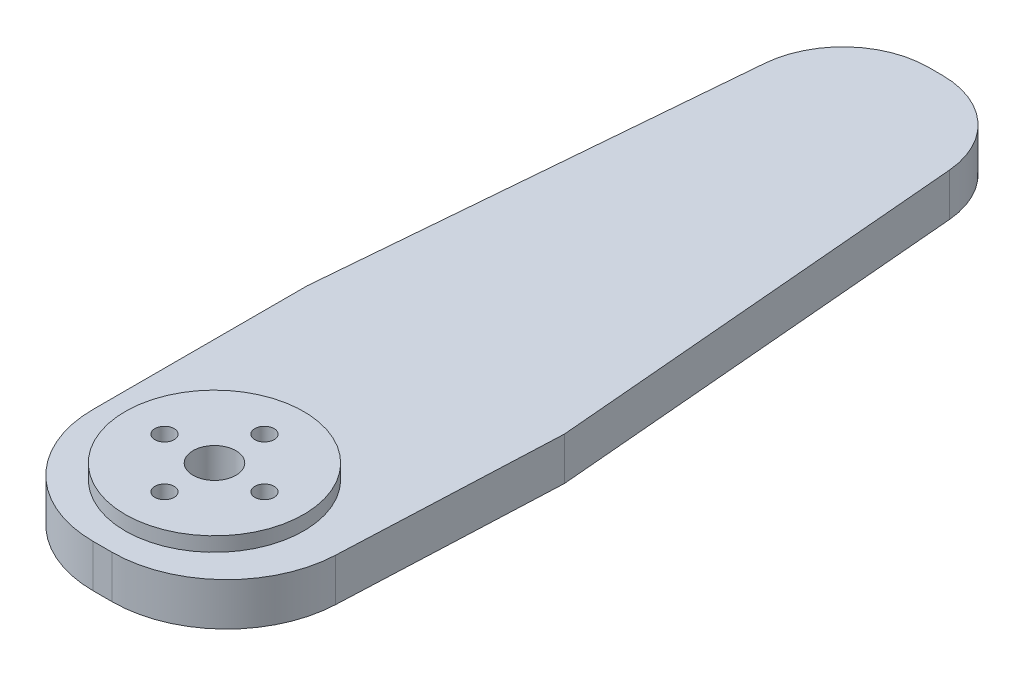
from build123d import *

# Parameters (mm, degrees)
BOSS_1_DEPTH = 6
S_CYL2_R     = 12.5
BOSS_2_DEPTH = 2
S_HOLE3_R    = 3
HOLE_3_DEPTH = 8.2
S_HOLE4_R    = 1.35
HOLE_4_DEPTH = 8.2
S_HOLE5_R    = 1.35
HOLE_5_DEPTH = 8.2
S_HOLE6_R    = 1.35
HOLE_6_DEPTH = 8.2
S_HOLE7_R    = 1.35
HOLE_7_DEPTH = 8.2


with BuildPart() as part:
    # S_prism1 → Boss_1 (new body)
    with BuildSketch(Plane(origin=(0, 0, 0), x_dir=(1, 0, 0), z_dir=(0, 1, 0))):
        with BuildLine():
            Line((-1, -16), (1.6805, -16))
            ThreePointArc((1.6805, -16), (12.745771818, -11.556826983), (17.6654, -0.695))
            Line((17.6654, -0.695), (19, 30))
            Line((19, 30), (13.9407, 89.0248))
            ThreePointArc((13.9407, 89.0248), (10.099439666, 96.840163588), (1.9846, 100))
            Line((1.9846, 100), (0.0154, 100))
            ThreePointArc((0.0154, 100), (-8.099439666, 96.840163588), (-11.9407, 89.0248))
            Line((-11.9407, 89.0248), (-17, 30))
            Line((-17, 30), (-17, 0))
            ThreePointArc((-17, 0), (-12.3137, -11.3137), (-1, -16))
        make_face()
    extrude(amount=BOSS_1_DEPTH)

    # S_cyl2 → Boss_2 (add)
    with BuildSketch(Plane(origin=(0, 6, 0), x_dir=(1, 0, 0), z_dir=(0, 1, 0))):
        Circle(S_CYL2_R)
    extrude(amount=BOSS_2_DEPTH)

    # S_hole3 → Hole_3 (cut)
    with BuildSketch(Plane(origin=(0, -0.1, 0), x_dir=(1, 0, 0), z_dir=(0, 1, 0))):
        Circle(S_HOLE3_R)
    extrude(amount=HOLE_3_DEPTH, mode=Mode.SUBTRACT)

    # S_hole4 → Hole_4 (cut)
    with BuildSketch(Plane(origin=(0, -0.1, 0), x_dir=(1, 0, 0), z_dir=(0, 1, 0))):
        with Locations((7, 0)):
            Circle(S_HOLE4_R)
    extrude(amount=HOLE_4_DEPTH, mode=Mode.SUBTRACT)

    # S_hole5 → Hole_5 (cut)
    with BuildSketch(Plane(origin=(0, -0.1, 0), x_dir=(1, 0, 0), z_dir=(0, 1, 0))):
        with Locations((0, -7)):
            Circle(S_HOLE5_R)
    extrude(amount=HOLE_5_DEPTH, mode=Mode.SUBTRACT)

    # S_hole6 → Hole_6 (cut)
    with BuildSketch(Plane(origin=(0, -0.1, 0), x_dir=(1, 0, 0), z_dir=(0, 1, 0))):
        with Locations((-7, 0)):
            Circle(S_HOLE6_R)
    extrude(amount=HOLE_6_DEPTH, mode=Mode.SUBTRACT)

    # S_hole7 → Hole_7 (cut)
    with BuildSketch(Plane(origin=(0, -0.1, 0), x_dir=(1, 0, 0), z_dir=(0, 1, 0))):
        with Locations((0, 7)):
            Circle(S_HOLE7_R)
    extrude(amount=HOLE_7_DEPTH, mode=Mode.SUBTRACT)


solid = part.part
